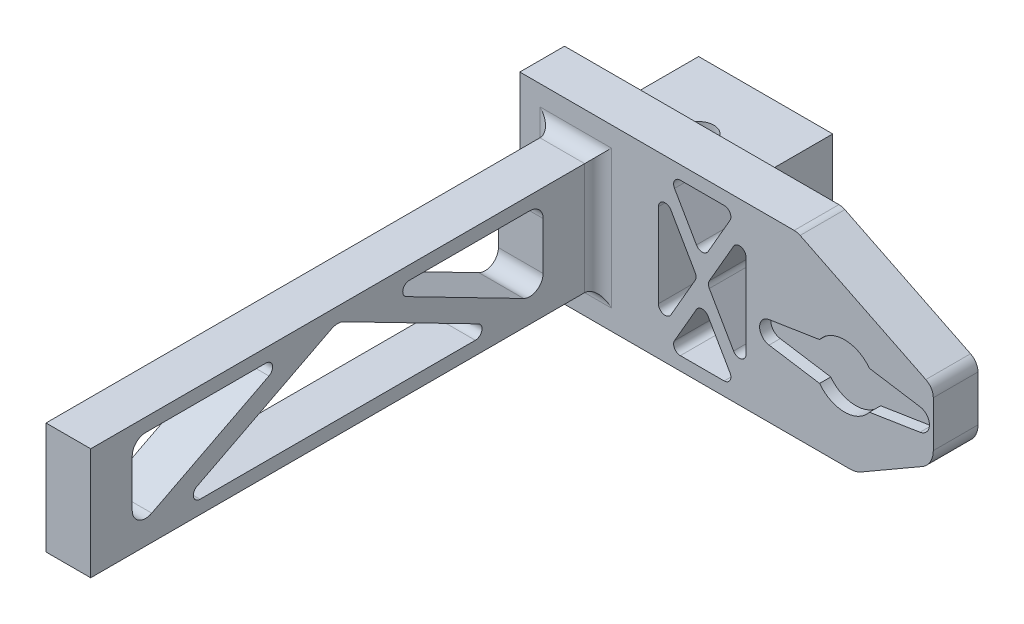
from build123d import *

# Parameters (mm, degrees)
SKETCH3_W             = 42.5
SKETCH3_H             = 15
BOSS_EXTRUDE1_DEPTH   = 10
SKETCH2_R             = 7.012606221
CUT_EXTRUDE1_DEPTH    = 2.5
SKETCH11_W            = 42.5
SKETCH11_H            = 10
BOSS_EXTRUDE5_DEPTH   = 10
SKETCH14_W            = 42.5
SKETCH14_H            = 10
BOSS_EXTRUDE7_DEPTH   = 15
SKETCH20_W            = 10
SKETCH20_H            = 40
BOSS_EXTRUDE10_DEPTH  = 50
SKETCH21_W            = 10
SKETCH21_H            = 25
BOSS_EXTRUDE11_DEPTH  = 113.5
SKETCH22_W            = 30
SKETCH22_H            = 6
BOSS_EXTRUDE12_DEPTH  = 30
SKETCH23_W            = 30
SKETCH23_H            = 30
BOSS_EXTRUDE13_DEPTH  = 8.5
FILLET1_R             = 3
CHAMFER1_SIZE         = 15
CHAMFER1_SIZE2        = 30.41699103
FILLET2_R             = 3
CHAMFER2_SIZE         = 10
CHAMFER2_SIZE2        = 17.320508076
FILLET3_R             = 5
CUT_EXTRUDE2_DEPTH    = 144.583262507
FILLET4_R             = 3
FILLET5_R             = 1.5
M8_TAPPED_HOLE1_D     = 6.8
M8_TAPPED_HOLE1_DEPTH = 22.25
M8_TAPPED_HOLE1_TIP   = 2.042926105
CUT_EXTRUDE3_DEPTH    = 141.312152004
FILLET6_R             = 1.5


with BuildPart() as part:
    # Sketch3 → Boss-Extrude1 (new body)
    with BuildSketch(Plane.XY):
        with Locations((-1.388845539, 0.05888455)):
            Rectangle(SKETCH3_W, SKETCH3_H)
    extrude(amount=-BOSS_EXTRUDE1_DEPTH)

    # Sketch2 → Cut-Extrude1 (cut)
    with BuildSketch(Plane.XY):
        Circle(SKETCH2_R)
        with BuildLine():
            Line((-16.888114198, 2.469689731), (-3.968626967, 4.5))
            ThreePointArc((-3.968626967, 4.5), (0, 6), (3.968626967, 4.5))
            Line((3.968626967, 4.5), (16.888114198, 2.469689731))
            ThreePointArc((16.888114198, 2.469689731), (19, 0), (16.888114198, -2.469689731))
            Line((16.888114198, -2.469689731), (3.968626967, -4.5))
            ThreePointArc((3.968626967, -4.5), (0, -6), (-3.968626967, -4.5))
            Line((-3.968626967, -4.5), (-16.888114198, -2.469689731))
            ThreePointArc((-16.888114198, -2.469689731), (-19, 0), (-16.888114198, 2.469689731))
        make_face()
    extrude(amount=-CUT_EXTRUDE1_DEPTH, mode=Mode.SUBTRACT)

    # Sketch11 → Boss-Extrude5 (add)
    with BuildSketch(Plane.XZ.offset(7.44111545)):
        with Locations((-1.388845539, -5)):
            Rectangle(SKETCH11_W, SKETCH11_H)
    extrude(amount=BOSS_EXTRUDE5_DEPTH)

    # Sketch14 → Boss-Extrude7 (add)
    with BuildSketch(Plane(origin=(0, 7.55888455, 0), x_dir=(1, 0, 0), z_dir=(0, 1, 0))):
        with Locations((-1.388845539, 5)):
            Rectangle(SKETCH14_W, SKETCH14_H)
    extrude(amount=BOSS_EXTRUDE7_DEPTH)

    # Sketch20 → Boss-Extrude10 (add)
    with BuildSketch(Plane.ZY.offset(22.638845539)):
        with Locations((-5, 2.55888455)):
            Rectangle(SKETCH20_W, SKETCH20_H)
    extrude(amount=BOSS_EXTRUDE10_DEPTH)

    # Sketch21 → Boss-Extrude11 (add)
    with BuildSketch(Plane.XY):
        with Locations((-60.138845539, 2.55888455)):
            Rectangle(SKETCH21_W, SKETCH21_H)
    extrude(amount=BOSS_EXTRUDE11_DEPTH)

    # Sketch22 → Boss-Extrude12 (add)
    with BuildSketch(Plane(origin=(0, 0, -10), x_dir=(-1, 0, 0), z_dir=(0, 0, -1))):
        with Locations((57.638845539, 2.55888455)):
            Rectangle(SKETCH22_W, SKETCH22_H)
    extrude(amount=BOSS_EXTRUDE12_DEPTH)

    # Sketch23 → Boss-Extrude13 (add)
    with BuildSketch(Plane.XZ.offset(0.44111545)):
        with Locations((-57.638845539, -25)):
            Rectangle(SKETCH23_W, SKETCH23_H)
    extrude(amount=BOSS_EXTRUDE13_DEPTH)

    # Fillet1
    fillet1_edges = [part.edges().sort_by_distance(p)[0] for p in [
        (-60.138845539, 15.05888455, 0),
        (-65.138845539, 2.55888455, 0),
        (-55.138845539, 2.55888455, 0),
        (-60.138845539, -9.94111545, 0),
    ]]
    fillet(fillet1_edges, radius=FILLET1_R)

    # Chamfer1
    chamfer1_edges = [part.edges().sort_by_distance(p)[0] for p in [
        (19.861154461, 22.55888455, -5),
    ]]
    chamfer1_side = [part.faces().sort_by_distance(p)[0] for p in [
        (19.861154461, 2.55888455, -5),
    ]]
    chamfer(chamfer1_edges, length=CHAMFER1_SIZE, length2=CHAMFER1_SIZE2, reference=chamfer1_side[0])

    # Fillet2
    fillet2_edges = [part.edges().sort_by_distance(p)[0] for p in [
        (-10.555836569, 22.55888455, -5),
        (19.861154461, 7.55888455, -5),
    ]]
    fillet(fillet2_edges, radius=FILLET2_R)

    # Chamfer2
    chamfer2_edges = [part.edges().sort_by_distance(p)[0] for p in [
        (19.861154461, -17.44111545, -5),
    ]]
    chamfer2_side = [part.faces().sort_by_distance(p)[0] for p in [
        (19.861154461, -5.873875391, -5),
    ]]
    chamfer(chamfer2_edges, length=CHAMFER2_SIZE, length2=CHAMFER2_SIZE2, reference=chamfer2_side[0])

    # Fillet3
    fillet3_edges = [part.edges().sort_by_distance(p)[0] for p in [
        (2.540646385, -17.44111545, -5),
        (19.861154461, -7.44111545, -5),
    ]]
    fillet(fillet3_edges, radius=FILLET3_R)

    # Sketch24 → Cut-Extrude2 (cut, through all)
    with BuildSketch(Plane.ZY.offset(65.138845539)):
        Polygon((58.25, -6.94111545), (95.25, -6.94111545), (58.25, 12.05888455), (21.25, -6.94111545), align=None)
        Polygon((48.39896268, 12.05888455), (12.290027833, -6.483541453), (12.290027833, 12.05888455), align=None)
        Polygon((68.10103732, 12.05888455), (104.209972167, 12.05888455), (104.209972167, -6.483541453), align=None)
    extrude(amount=-CUT_EXTRUDE2_DEPTH, mode=Mode.SUBTRACT)

    # Fillet4
    fillet4_edges = [part.edges().sort_by_distance(p)[0] for p in [
        (-60.138845539, -6.483541453, 12.290027833),
        (-60.138845539, 12.05888455, 12.290027833),
        (-60.138845539, -6.483541453, 104.209972167),
        (-60.138845539, 12.05888455, 104.209972167),
        (-60.138845539, 12.05888455, 58.25),
    ]]
    fillet(fillet4_edges, radius=FILLET4_R)

    # Fillet5
    fillet5_edges = [part.edges().sort_by_distance(p)[0] for p in [
        (-60.138845539, 12.05888455, 68.10103732),
        (-60.138845539, -6.94111545, 95.25),
        (-60.138845539, -6.94111545, 21.25),
        (-60.138845539, 12.05888455, 48.39896268),
    ]]
    fillet(fillet5_edges, radius=FILLET5_R)

    # M8 Tapped Hole1
    with Locations(Plane(origin=(0, 5.55888455, 0), x_dir=(1, 0, 0), z_dir=(0, 1, 0))):
        with Locations((-57.638845539, 25)):
            Hole(M8_TAPPED_HOLE1_D / 2, depth=M8_TAPPED_HOLE1_DEPTH)
            with Locations((0, 0, -(M8_TAPPED_HOLE1_DEPTH + M8_TAPPED_HOLE1_TIP / 2))):  # 118° drill point
                Cone(0, M8_TAPPED_HOLE1_D / 2, M8_TAPPED_HOLE1_TIP, mode=Mode.SUBTRACT)

    # Sketch32 → Cut-Extrude3 (cut, through all)
    with BuildSketch(Plane(origin=(-42.638845539, 5.55888455, -10), x_dir=(1, 0, 0), z_dir=(0, 0, 1))):
        Polygon((10.809559843, 14), (3.309559843, 14), (10.809559843, 1.002474929), (18.309559843, 14), align=None)
        Polygon((1, 12), (9.65549398, -3), (1, -18), (1, -3), align=None)
        Polygon((10.809559843, -7.002474929), (18.309559843, -20), (10.809559843, -20), (3.309559843, -20), align=None)
        Polygon((20.619119687, -18), (20.619119687, -3), (20.619119687, 12), (11.963625707, -3), align=None)
    extrude(amount=CUT_EXTRUDE3_DEPTH, mode=Mode.SUBTRACT)

    # Fillet6
    fillet6_edges = [part.edges().sort_by_distance(p)[0] for p in [
        (-41.638845539, 17.55888455, -5),
        (-31.829285696, 6.561359479, -5),
        (-39.329285696, 19.55888455, -5),
        (-24.329285696, 19.55888455, -5),
        (-22.019725852, -12.44111545, -5),
        (-22.019725852, 17.55888455, -5),
        (-30.675219832, 2.55888455, -5),
        (-39.329285696, -14.44111545, -5),
        (-24.329285696, -14.44111545, -5),
        (-31.829285696, -1.44359038, -5),
        (-41.638845539, -12.44111545, -5),
        (-32.98335156, 2.55888455, -5),
    ]]
    fillet(fillet6_edges, radius=FILLET6_R)


solid = part.part
